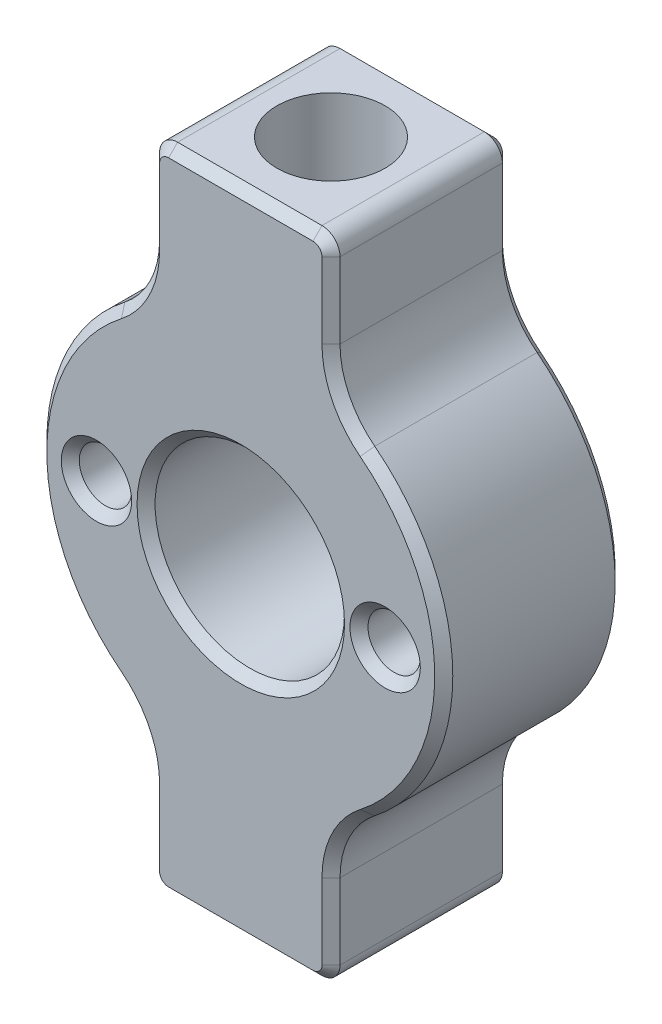
from build123d import *

# Parameters (mm, degrees)
SKIZZE1_R                       = 11.25
SKIZZE1_R_2                     = 5.25
AUFSATZ_LINEAR_AUSTRAGEN1_DEPTH = 10
AUFSATZ_LINEAR_START            = 6
SKIZZE2_W                       = 10
SKIZZE2_H                       = 10
AUFSATZ_LINEAR_AUSTRAGEN2_DEPTH = 12
SKIZZE3_R                       = 3
SCHNITT_LINEAR_AUSTRAGEN1_DEPTH = 10
SKIZZE4_R                       = 1.45
SCHNITT_LINEAR_AUSTRAGEN2_DEPTH = 8
VERRUNDUNG2_R                   = 5
VERRUNDUNG1_R                   = 1
FASE1_SIZE                      = 0.5


with BuildPart() as part:
    # Skizze1 → Aufsatz-Linear austragen1 (new body)
    with BuildSketch(Plane.XY):
        Circle(SKIZZE1_R)
        Circle(SKIZZE1_R_2, mode=Mode.SUBTRACT)
    extrude(amount=AUFSATZ_LINEAR_AUSTRAGEN1_DEPTH)

    # Skizze2 → Aufsatz-Linear austragen2 (add)
    with BuildSketch(Plane(origin=(0, 0, 0), x_dir=(1, 0, 0), z_dir=(0, 1, 0)).offset(AUFSATZ_LINEAR_START)):
        with Locations((0, -5)):
            Rectangle(SKIZZE2_W, SKIZZE2_H)
    aufsatz_linear_austragen2 = extrude(amount=AUFSATZ_LINEAR_AUSTRAGEN2_DEPTH)

    # Skizze3 → Schnitt-Linear austragen1 (cut)
    with BuildSketch(Plane(origin=(0, 18, 0), x_dir=(1, 0, 0), z_dir=(0, 1, 0))):
        with Locations((0, -5)):
            Circle(SKIZZE3_R)
    schnitt_linear_austragen1 = extrude(amount=-SCHNITT_LINEAR_AUSTRAGEN1_DEPTH, mode=Mode.SUBTRACT)

    # Spiegeln1: Aufsatz-Linear austragen2, Schnitt-Linear austragen1 across plane
    add(aufsatz_linear_austragen2.mirror(Plane.ZX))
    add(schnitt_linear_austragen1.mirror(Plane.ZX), mode=Mode.SUBTRACT)

    # Skizze4 → Schnitt-Linear austragen2 (cut)
    with BuildSketch(Plane.XY.offset(10)):
        with Locations((8, 0)):
            Circle(SKIZZE4_R)
        with Locations((-8, 0)):
            Circle(SKIZZE4_R)
    extrude(amount=-SCHNITT_LINEAR_AUSTRAGEN2_DEPTH, mode=Mode.SUBTRACT)

    # Verrundung2
    verrundung2_edges = [part.edges().sort_by_distance(p)[0] for p in [
        (-5, -10.077822185, 5),
        (-5, 10.077822185, 5),
        (5, 10.077822185, 5),
        (5, -10.077822185, 5),
    ]]
    fillet(verrundung2_edges, radius=VERRUNDUNG2_R)

    # Verrundung1
    verrundung1_edges = [part.edges().sort_by_distance(p)[0] for p in [
        (-5, 18, 5),
        (5, 18, 5),
        (5, -18, 5),
        (-5, -18, 5),
    ]]
    fillet(verrundung1_edges, radius=VERRUNDUNG1_R)

    # Fase1
    fase1_edges = [part.edges().sort_by_distance(p)[0] for p in [
        (-5.25, 0, 10),
        (-5, 14.904344229, 10),
        (0, 18, 10),
        (5, 14.904344229, 10),
        (5, -14.904344229, 10),
        (0, -18, 10),
        (-5, -14.904344229, 10),
        (-5.25, 0, 0),
        (5, 14.904344229, 0),
        (0, 18, 0),
        (-5, 14.904344229, 0),
        (-5, -14.904344229, 0),
        (0, -18, 0),
        (5, -14.904344229, 0),
        (5.506414829, 10.616043409, 10),
        (11.25, 0, 10),
        (5.506414829, -10.616043409, 10),
        (-5.506414829, -10.616043409, 10),
        (-11.25, 0, 10),
        (-5.506414829, 10.616043409, 10),
        (5.506414829, 10.616043409, 0),
        (-5.506414829, 10.616043409, 0),
        (-11.25, 0, 0),
        (-5.506414829, -10.616043409, 0),
        (5.506414829, -10.616043409, 0),
        (11.25, 0, 0),
        (-9.45, 0, 10),
        (6.55, 0, 10),
        (4.707106781, 17.707106781, 10),
        (4.707106781, -17.707106781, 10),
        (-4.707106781, -17.707106781, 10),
        (-4.707106781, 17.707106781, 10),
        (-4.707106781, -17.707106781, 0),
        (4.707106781, -17.707106781, 0),
        (4.707106781, 17.707106781, 0),
        (-4.707106781, 17.707106781, 0),
    ]]
    chamfer(fase1_edges, length=FASE1_SIZE)


solid = part.part
